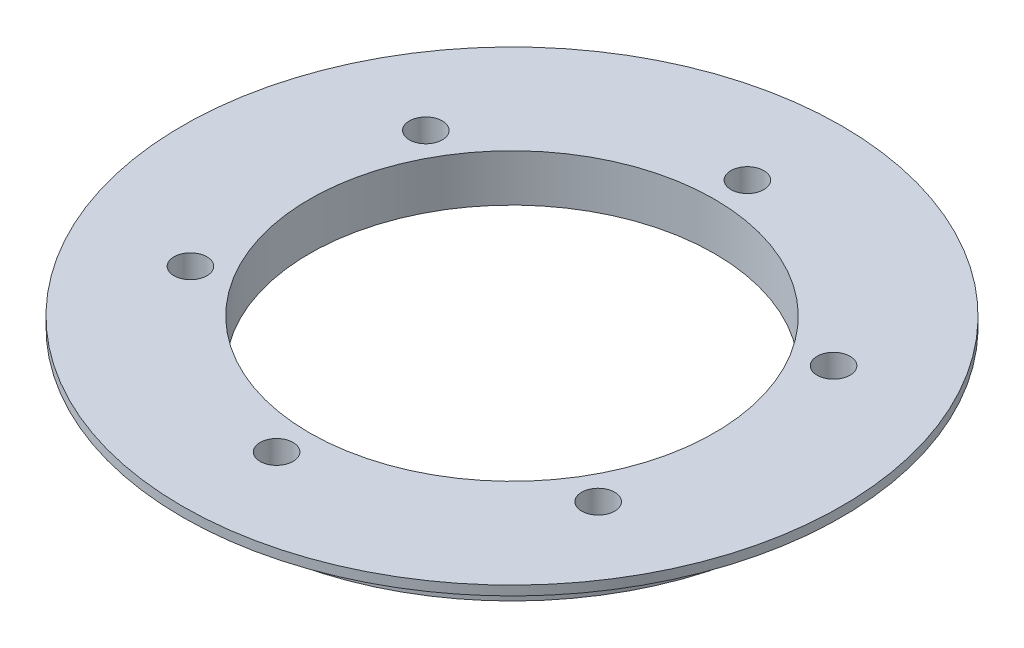
from build123d import *

# Parameters (mm, degrees)
SKETCH1_R           = 30
BOSS_EXTRUDE1_DEPTH = 5
SKETCH2_R           = 35
BOSS_EXTRUDE2_DEPTH = 1
SKETCH3_R           = 21.5
CUT_EXTRUDE1_DEPTH  = 25
SKETCH4_R           = 1.75
CUT_EXTRUDE2_DEPTH  = 25


with BuildPart() as part:
    # Sketch1 → Boss-Extrude1 (new body)
    with BuildSketch(Plane(origin=(0, 0, 0), x_dir=(1, 0, 0), z_dir=(0, 1, 0))):
        Circle(SKETCH1_R)
    extrude(amount=BOSS_EXTRUDE1_DEPTH)

    # Sketch2 → Boss-Extrude2 (add)
    with BuildSketch(Plane(origin=(0, 5, 0), x_dir=(1, 0, 0), z_dir=(0, 1, 0))):
        Circle(SKETCH2_R)
    extrude(amount=-BOSS_EXTRUDE2_DEPTH)

    # Sketch3 → Cut-Extrude1 (cut)
    with BuildSketch(Plane.XZ):
        Circle(SKETCH3_R)
    extrude(amount=-CUT_EXTRUDE1_DEPTH, mode=Mode.SUBTRACT)

    # Sketch4 → Cut-Extrude2 (cut)
    with BuildSketch(Plane(origin=(0, 5, 0), x_dir=(1, 0, 0), z_dir=(0, 1, 0))):
        with Locations((0, 25)):
            Circle(SKETCH4_R)
        with Locations((21.650635095, 12.5)):
            Circle(SKETCH4_R)
        with Locations((21.650635095, -12.5)):
            Circle(SKETCH4_R)
        with Locations((0, -25)):
            Circle(SKETCH4_R)
        with Locations((-21.650635095, -12.5)):
            Circle(SKETCH4_R)
        with Locations((-21.650635095, 12.5)):
            Circle(SKETCH4_R)
    extrude(amount=-CUT_EXTRUDE2_DEPTH, mode=Mode.SUBTRACT)


solid = part.part
